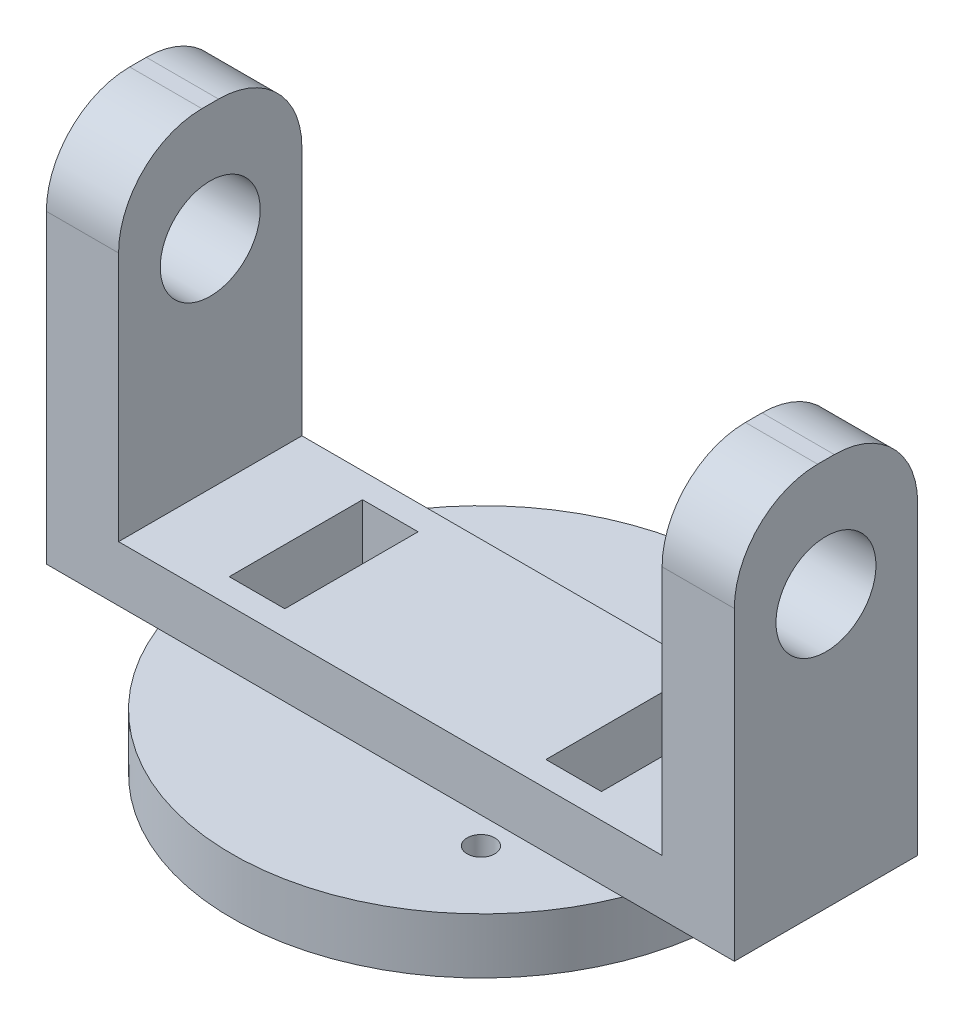
from build123d import *

# Parameters (mm, degrees)
SKETCH1_W           = 123.84
SKETCH1_H           = 33
BOSS_EXTRUDE1_DEPTH = 10
SKETCH2_W           = 13
SKETCH2_H           = 33
BOSS_EXTRUDE2_DEPTH = 60
SKETCH3_R           = 9
CUT_EXTRUDE1_DEPTH  = 144.208224624
SKETCH10_R          = 45
BOSS_EXTRUDE5_DEPTH = 10
SKETCH9_R           = 2.5
SKETCH9_W           = 10
SKETCH9_H           = 24
CUT_EXTRUDE3_DEPTH  = 98.257834646
FILLET1_R           = 15


with BuildPart() as part:
    # Sketch1 → Boss-Extrude1 (new body)
    with BuildSketch(Plane(origin=(0, 0, 0), x_dir=(1, 0, 0), z_dir=(0, 1, 0))):
        Rectangle(SKETCH1_W, SKETCH1_H)
    extrude(amount=BOSS_EXTRUDE1_DEPTH)

    # Sketch2 → Boss-Extrude2 (add)
    with BuildSketch(Plane(origin=(0, 10, 0), x_dir=(1, 0, 0), z_dir=(0, 1, 0))):
        with Locations((-55.42, 0)):
            Rectangle(SKETCH2_W, SKETCH2_H)
        with Locations((55.42, 0)):
            Rectangle(SKETCH2_W, SKETCH2_H)
    extrude(amount=BOSS_EXTRUDE2_DEPTH)

    # Sketch3 → Cut-Extrude1 (cut, through all)
    with BuildSketch(Plane(origin=(61.92, 0, 0), x_dir=(0, 0, -1), z_dir=(1, 0, 0))):
        with Locations((0, 49)):
            Circle(SKETCH3_R)
    extrude(amount=-CUT_EXTRUDE1_DEPTH, mode=Mode.SUBTRACT)

    # Sketch10 → Boss-Extrude5 (add)
    with BuildSketch(Plane.XZ):
        Circle(SKETCH10_R)
    extrude(amount=BOSS_EXTRUDE5_DEPTH)

    # Sketch9 → Cut-Extrude3 (cut, through all)
    with BuildSketch(Plane(origin=(0, 10, 0), x_dir=(1, 0, 0), z_dir=(0, 1, 0))):
        with Locations((21.118713953, -21.307273899)):
            Circle(SKETCH9_R)
        with Locations((21.307273899, 21.118713953)):
            Circle(SKETCH9_R)
        with Locations((-21.118713953, 21.307273899)):
            Circle(SKETCH9_R)
        with Locations((-28.5, 0)):
            Rectangle(SKETCH9_W, SKETCH9_H)
        with Locations((28.5, 0)):
            Rectangle(SKETCH9_W, SKETCH9_H)
    extrude(amount=-CUT_EXTRUDE3_DEPTH, mode=Mode.SUBTRACT)

    # Fillet1
    fillet1_edges = [part.edges().sort_by_distance(p)[0] for p in [
        (-55.42, 70, -16.5),
        (-55.42, 70, 16.5),
        (55.42, 70, 16.5),
        (55.42, 70, -16.5),
    ]]
    fillet(fillet1_edges, radius=FILLET1_R)


solid = part.part
